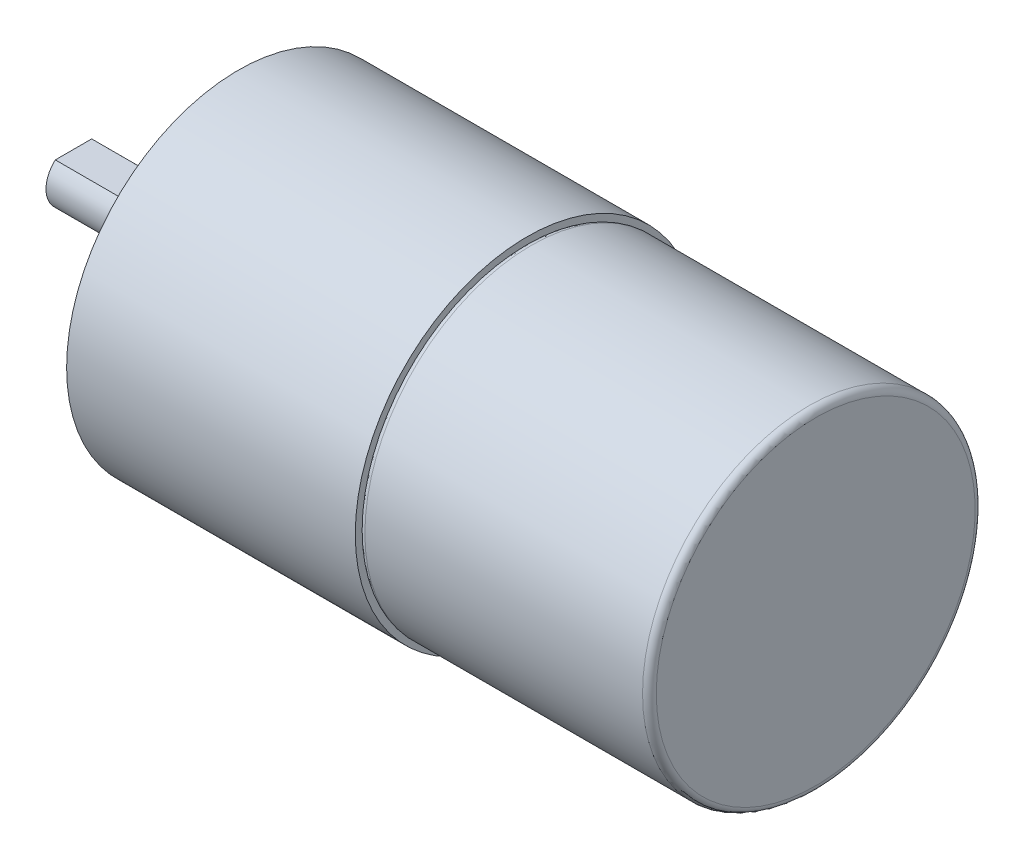
from build123d import *

# Parameters (mm, degrees)
FILLET1_R          = 0.5
SKETCH2_W          = 8
SKETCH2_H          = 0.5
CUT_EXTRUDE1_DEPTH = 5
SKETCH3_R          = 1.5
CUT_EXTRUDE2_DEPTH = 5


with BuildPart() as part:
    # Sketch1 → Revolve1 (revolve)
    with BuildSketch(Plane.XY, mode=Mode.PRIVATE) as revolve1_sk:
        Polygon((-27, 0), (27, 0), (27, 12.1), (6.1, 12.1), (6, 12), (6, 12.5), (-15, 12.5), (-15, 3.5), (-17.5, 3.5), (-17.5, 2), (-27, 2), align=None)
    revolve(revolve1_sk.sketch.rotate(Axis((-27, 0, 0), (1, 0, 0)), 90), axis=Axis((-27, 0, 0), (1, 0, 0)))

    # Fillet1
    # the kernel refuses this fillet: 0.5 mm, written as the material it takes off along each edge
    with BuildSketch(Plane(origin=(27, 0, 0), x_dir=(0, 0, 1), z_dir=(0, 1, 0))) as fillet1_piece_1:
        with BuildLine():
            CenterArc((12.1 - FILLET1_R, -FILLET1_R), FILLET1_R, 0, 90)
            Line((12.1, -FILLET1_R), (12.1 + FILLET1_R * 0.02, -FILLET1_R))
            Line((12.1 + FILLET1_R * 0.02, -FILLET1_R), (12.1 + FILLET1_R * 0.02, FILLET1_R * 0.02))
            Line((12.1 + FILLET1_R * 0.02, FILLET1_R * 0.02), (12.1 - FILLET1_R, FILLET1_R * 0.02))
            Line((12.1 - FILLET1_R, FILLET1_R * 0.02), (12.1 - FILLET1_R, 0))
        make_face()
    revolve(axis=Axis((27, 0, 0), (1, 0, 0)), mode=Mode.SUBTRACT)
    with BuildSketch(Plane(origin=(6.1, 0, 0), x_dir=(0, 0, 1), z_dir=(0, 1, 0))) as fillet1_piece_2_section:
        with BuildLine():
            CenterArc((11.6, 0.2), FILLET1_R, 323.130102354, 36.869897646)
            Line((12, -0.1), (12.008, -0.106))
            ThreePointArc((12.008, -0.106), (12.057071068, -0.057071068), (12.107071068, -0.007071068))
            Line((12.107071068, -0.007071068), (12.11, 0))
            Line((12.11, 0), (12.11, 0.2))
            Line((12.11, 0.2), (12.1, 0.2))
        make_face()
    fillet1_piece_2 = revolve(axis=Axis((6.1, 0, 0), (1, 0, 0)), mode=Mode.PRIVATE)
    fillet1_piece_2 = split(fillet1_piece_2, bisect_by=Plane(origin=(6, 0, -12.082361586), z_dir=(1, 0, 0)), keep=Keep.TOP, mode=Mode.PRIVATE)
    add(fillet1_piece_2, mode=Mode.SUBTRACT)

    # Sketch2 → Cut-Extrude1 (cut, symmetric)
    with BuildSketch(Plane.XY):
        with Locations((-23, 1.75)):
            Rectangle(SKETCH2_W, SKETCH2_H)
    extrude(amount=CUT_EXTRUDE1_DEPTH, both=True, mode=Mode.SUBTRACT)

    # Sketch3 → Cut-Extrude2 (cut)
    with BuildSketch(Plane.ZY.offset(15)):
        with Locations((0, 8.5)):
            Circle(SKETCH3_R)
        with Locations((0, -8.5)):
            Circle(SKETCH3_R)
    extrude(amount=-CUT_EXTRUDE2_DEPTH, mode=Mode.SUBTRACT)


solid = part.part
